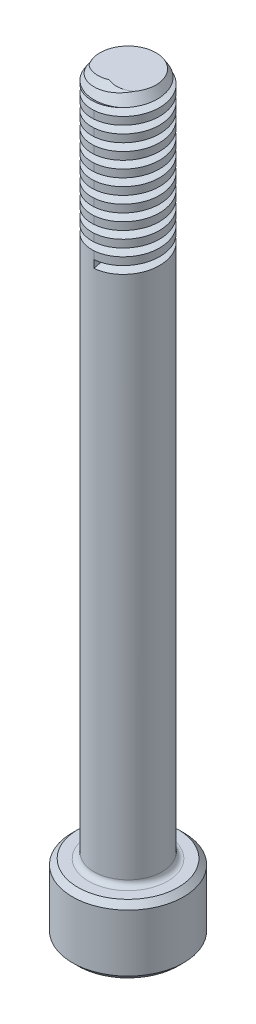
from build123d import *

# Parameters (mm, degrees)
CUT_SWEEP1_PITCH   = 0.635
CUT_EXTRUDE1_DEPTH = 1.2954
FILLET1_R          = 0.2286
FILLET2_R          = 0.396875794
CHAMFER2_SIZE      = 0.2286
CHAMFER3_SIZE      = 0.127


with BuildPart() as part:
    # Sketch1 → Revolve1 (revolve)
    with BuildSketch(Plane.XY, mode=Mode.PRIVATE) as revolve1_sk:
        Polygon((0, 0), (0, 31.4198), (1.4224, 31.4198), (1.4224, 2.8448), (2.3241, 2.8448), (2.3241, 0), align=None)
    revolve(revolve1_sk.sketch.rotate(Axis((0, 0, 0), (0, 1, 0)), 90), axis=Axis((0, 0, 0), (0, 1, 0)))

    # Cut-Sweep1: arcs per turn and ends read off the stored shape
    # Cut-Sweep1: the profile of Sketch3 profile screwed along a right-hand helix through 11 turns, 6 arcs to a turn; built about Z, then put on its axis
    cut_sweep1_z = Axis((0, 0, 0), (0, 0, 1))
    cut_sweep1_corners = [(1.4227, 0, -0.476175), (1.4227, 0, -0.793825), (0.78739873, 0, -0.635)]
    with BuildLine(mode=Mode.PRIVATE) as cut_sweep1_profile:
        Line(cut_sweep1_corners[0], cut_sweep1_corners[1])
        Line(cut_sweep1_corners[1], cut_sweep1_corners[2])
        Line(cut_sweep1_corners[2], cut_sweep1_corners[0])
    cut_sweep1_cap = Face(cut_sweep1_profile.wire())
    cut_sweep1_turn_angles = [0, 30, 60, 90, 120, 150, 180, 210, 240, 270, 300, 330, 360]
    cut_sweep1_turn_weights = [1, 0.8660254037844387, 1, 0.8660254037844387, 1, 0.8660254037844387, 1, 0.8660254037844387, 1, 0.8660254037844387, 1, 0.8660254037844387, 1]
    cut_sweep1_turn_rails = [Edge.make_bspline([Vector(p[0], p[1], 0).rotate(cut_sweep1_z, cut_sweep1_turn_angles[k]) / cut_sweep1_turn_weights[k] + Vector(0, 0, p[2] + CUT_SWEEP1_PITCH * cut_sweep1_turn_angles[k] / 360) for k in range(13)], [0, 0, 0, 1, 1, 2, 2, 3, 3, 4, 4, 5, 5, 6, 6, 6], 2, cut_sweep1_turn_weights) for p in cut_sweep1_corners]
    cut_sweep1_turn_sides = [Face.make_surface_from_curves(cut_sweep1_turn_rails[p[0]], cut_sweep1_turn_rails[p[1]]) for p in [(0, 1), (1, 2), (2, 0)]]
    cut_sweep1 = Plane(origin=(0, 31.4198, 0), x_dir=(0, 0, 1), z_dir=(0, -1, 0)) * Solid(Shell([*[p.moved(Location((0, 0, CUT_SWEEP1_PITCH * i))) for i in range(11) for p in cut_sweep1_turn_sides], cut_sweep1_cap, cut_sweep1_cap.rotate(cut_sweep1_z, 3960).moved(Location((0, 0, CUT_SWEEP1_PITCH * 3960 / 360)))]))
    add(cut_sweep1, mode=Mode.SUBTRACT)

    # Sketch4 → Cut-Extrude1 (cut)
    with BuildSketch(Plane(origin=(0, 0, 0), x_dir=(1, 0, 0), z_dir=(0, 1, 0))):
        Polygon((0, 1.378481503), (-1.1938, 0.689240751), (-1.1938, -0.689240751), (0, -1.378481503), (1.1938, -0.689240751), (1.1938, 0.689240751), align=None)
    extrude(amount=CUT_EXTRUDE1_DEPTH, mode=Mode.SUBTRACT)

    # Fillet1
    fillet1_edges = [part.edges().sort_by_distance(p)[0] for p in [
        (0, 2.8448, 1.4224),
    ]]
    fillet(fillet1_edges, radius=FILLET1_R)

    # Fillet2
    fillet2_edges = [part.edges().sort_by_distance(p)[0] for p in [
        (1.1938, 0.6477, -0.689240751),
        (0, 0.6477, -1.378481503),
        (-1.1938, 0.6477, -0.689240751),
        (-1.1938, 0.6477, 0.689240751),
        (0, 0.6477, 1.378481503),
        (1.1938, 0.6477, 0.689240751),
        (0.5969, 1.2954, -1.033861127),
        (-0.5969, 1.2954, -1.033861127),
        (-1.1938, 1.2954, 0),
        (-0.5969, 1.2954, 1.033861127),
        (0.5969, 1.2954, 1.033861127),
        (1.1938, 1.2954, 0),
    ]]
    fillet(fillet2_edges, radius=FILLET2_R)

    # Chamfer1: read off the stored shape, not the designer's step
    # Chamfer1 outline → Chamfer1 (revolve, cut)
    with BuildSketch(Plane.XY):
        Polygon((1.4224, 31.4198), (1.168399492, 31.4198), (1.4224, 31.008376279), align=None)
    revolve(axis=Axis((0, 0, 0), (0, 1, 0)), mode=Mode.SUBTRACT)

    # Chamfer2
    chamfer2_edges = [part.edges().sort_by_distance(p)[0] for p in [
        (0, 0, 2.3241),
        (0, 2.8448, 2.3241),
    ]]
    chamfer(chamfer2_edges, length=CHAMFER2_SIZE)

    # Chamfer3
    chamfer3_edges = [part.edges().sort_by_distance(p)[0] for p in [
        (0.5969, 0, -1.033861127),
        (-0.5969, 0, -1.033861127),
        (-1.1938, 0, 0),
        (-0.5969, 0, 1.033861127),
        (0.5969, 0, 1.033861127),
        (1.1938, 0, 0),
        (0, 0, -1.317084604),
        (1.140628726, 0, -0.658542302),
        (1.140628726, 0, 0.658542302),
        (0, 0, 1.317084604),
        (-1.140628726, 0, 0.658542302),
        (-1.140628726, 0, -0.658542302),
    ]]
    chamfer(chamfer3_edges, length=CHAMFER3_SIZE)


solid = part.part
